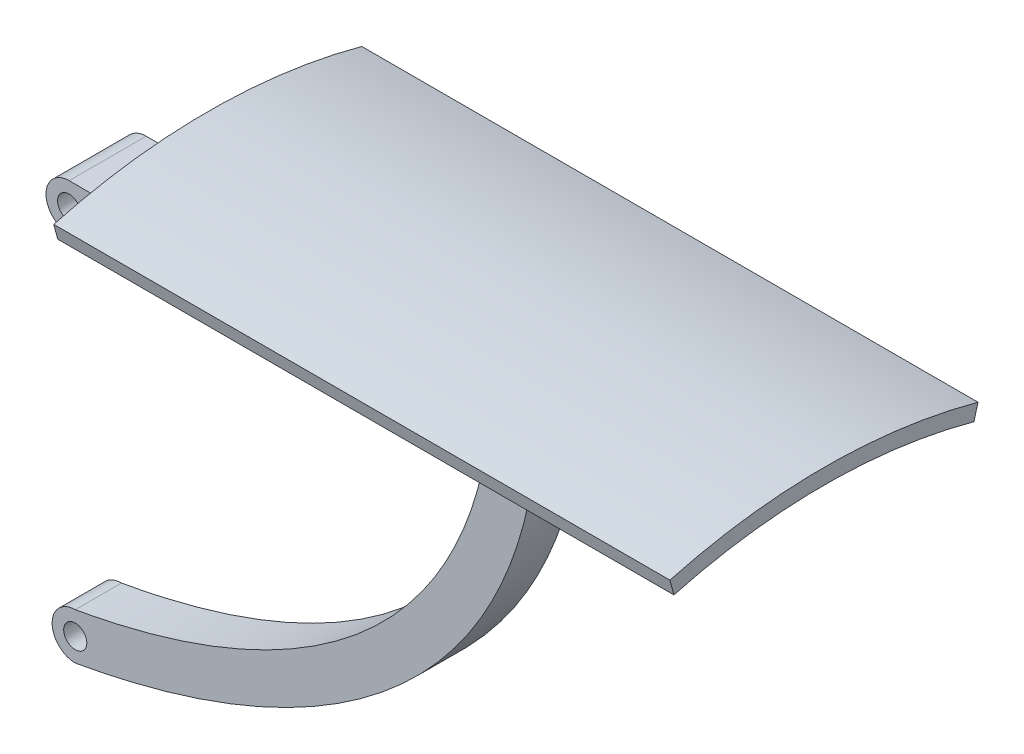
from build123d import *

# Parameters (mm, degrees)
BOSS_EXTRU_1_DEPTH      = 80
BOSS_EXTRU_3_DEPTH      = 5
BOSS_EXTRU_3_DEPTH_BACK = 5
ESQUISSE7_R             = 1.5
BOSS_EXTRU_2_DEPTH      = 3
BOSS_EXTRU_2_DEPTH_BACK = 3
ESQUISSE3_R             = 1.5


with BuildPart() as part:
    # Esquisse1 → Boss.-Extru.1 (new body)
    with BuildSketch(Plane(origin=(0, 0, 0), x_dir=(0, 0, -1), z_dir=(1, 0, 0))):
        with BuildLine():
            Line((-20, 73.528497877), (-19.475065617, 71.598616043))
            ThreePointArc((-19.475065617, 71.598616043), (0, 74.2), (19.475065617, 71.598616043))
            Line((19.475065617, 71.598616043), (20, 73.528497877))
            ThreePointArc((20, 73.528497877), (0, 76.2), (-20, 73.528497877))
        make_face()
    extrude(amount=BOSS_EXTRU_1_DEPTH)

    # Esquisse7 → Boss.-Extru.3 (add, two sides: drawn at the far end of the back side and taken through both)
    with BuildSketch(Plane.XY.offset(-BOSS_EXTRU_3_DEPTH_BACK)):
        with BuildLine():
            Line((7, 74.2), (7, 66.447578676))
            Line((7, 66.447578676), (-4.389191535, 64.43935692))
            Line((-4.389191535, 64.43935692), (-13, 64.43935692))
            ThreePointArc((-13, 64.43935692), (-16, 61.43935692), (-13, 58.43935692))
            Line((-13, 58.43935692), (-5.168187177, 58.43935692))
            Line((-5.168187177, 58.43935692), (13, 61.64289851))
            Line((13, 61.64289851), (13, 74.2))
            Line((13, 74.2), (7, 74.2))
        make_face()
        with Locations((-13, 61.43935692)):
            Circle(ESQUISSE7_R, mode=Mode.SUBTRACT)
    extrude(amount=BOSS_EXTRU_3_DEPTH + BOSS_EXTRU_3_DEPTH_BACK)

    # Esquisse3 → Boss.-Extru.2 (add, two sides: drawn at the far end of the back side and taken through both)
    with BuildSketch(Plane.XY.offset(-BOSS_EXTRU_2_DEPTH_BACK)):
        with BuildLine():
            Line((40, 74.2), (40, 69.2))
            add(Edge.make_bspline(
                [(40, 69.2), (40, 41.394963761), (21.706530828, 20.932235353), (-14.203822355, 14.6002712)],
                knots=[0, 0, 0, 0, 1, 1, 1, 1], degree=3))
            ThreePointArc((-14.203822355, 14.6002712), (-17.203822355, 11.6002712), (-14.203822355, 8.6002712))
            add(Edge.make_bspline(
                [(46, 69.2), (46, 38.106516096), (25.19343521, 15.547070675), (-14.203822355, 8.6002712)],
                knots=[0, 0, 0, 0, 1, 1, 1, 1], degree=3))
            Line((46, 69.2), (46, 74.2))
            Line((46, 74.2), (40, 74.2))
        make_face()
        with Locations((-14.203822355, 11.6002712)):
            Circle(ESQUISSE3_R, mode=Mode.SUBTRACT)
    extrude(amount=BOSS_EXTRU_2_DEPTH + BOSS_EXTRU_2_DEPTH_BACK)


solid = part.part
